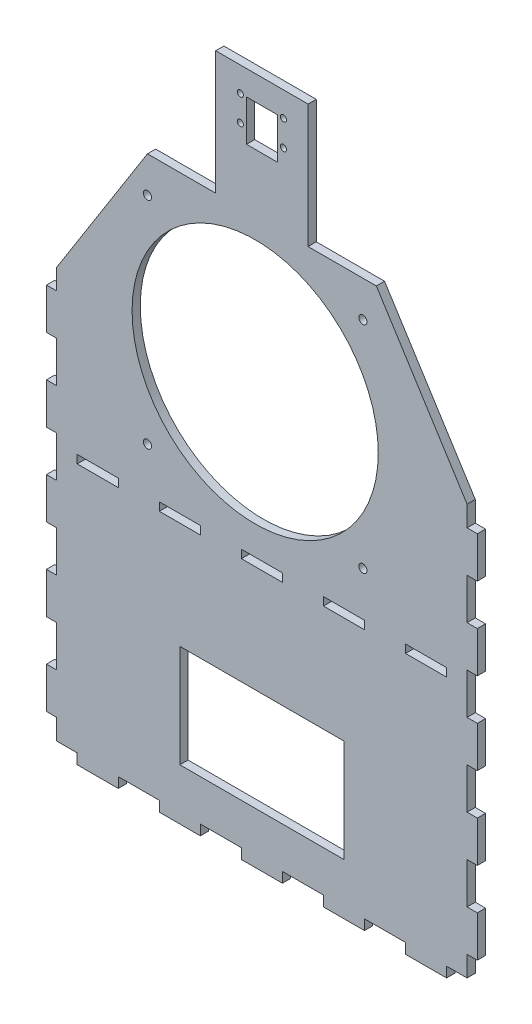
from build123d import *

# Parameters (mm, degrees)
SKICA1_W                = 20
SKICA1_H                = 4
SKICA1_R                = 2
SKICA1_W_2              = 80
SKICA1_H_2              = 50
SKICA1_R_2              = 60
SKICA1_R_3              = 1.5
SKICA1_W_3              = 15
SKICA1_H_3              = 20
P_IDAT_VYSUNUT_M1_DEPTH = 4


with BuildPart() as part:
    # Skica1 → Přidat vysunutím1 (new body)
    with BuildSketch(Plane.XY):
        Polygon((-121.598141023, -103.240049383), (-121.598141023, -113.240049383), (-111.598141023, -113.240049383), (-111.598141023, -118.240049383), (-91.598141023, -118.240049383), (-91.598141023, -113.240049383), (-71.598141023, -113.240049383), (-71.598141023, -118.240049383), (-51.598141023, -118.240049383), (-51.598141023, -113.240049383), (-31.598141023, -113.240049383), (-31.598141023, -118.240049383), (-11.598141023, -118.240049383), (-11.598141023, -113.240049383), (8.401858977, -113.240049383), (8.401858977, -118.240049383), (28.401858977, -118.240049383), (28.401858977, -113.240049383), (48.401858977, -113.240049383), (48.401858977, -118.240049383), (68.401858977, -118.240049383), (68.401858977, -113.240049383), (78.401858977, -113.240049383), (78.401858977, -103.240049383), (83.401858977, -103.240049383), (83.401858977, -83.240049383), (78.401858977, -83.240049383), (78.401858977, -63.240049383), (83.401858977, -63.240049383), (83.401858977, -43.240049383), (78.401858977, -43.240049383), (78.401858977, -23.240049383), (83.401858977, -23.240049383), (83.401858977, -3.240049383), (78.401858977, -3.240049383), (78.401858977, 16.759950617), (83.401858977, 16.759950617), (83.401858977, 36.759950617), (78.401858977, 36.759950617), (78.401858977, 56.759950617), (83.401858977, 56.759950617), (83.401858977, 76.759950617), (78.401858977, 76.759950617), (78.401858977, 86.759950617), (34.183586154, 156.759950617), (0.901858977, 156.759950617), (0.901858977, 216.89905968), (-44.098141023, 216.89905968), (-44.098141023, 156.759950617), (-77.379868199, 156.759950617), (-121.598141023, 86.759950617), (-121.598141023, 76.759950617), (-126.598141023, 76.759950617), (-126.598141023, 56.759950617), (-121.598141023, 56.759950617), (-121.598141023, 36.759950617), (-126.598141023, 36.759950617), (-126.598141023, 16.759950617), (-121.598141023, 16.759950617), (-121.598141023, -3.240049383), (-126.598141023, -3.240049383), (-126.598141023, -23.240049383), (-121.598141023, -23.240049383), (-121.598141023, -43.240049383), (-126.598141023, -43.240049383), (-126.598141023, -63.240049383), (-121.598141023, -63.240049383), (-121.598141023, -83.240049383), (-126.598141023, -83.240049383), (-126.598141023, -103.240049383), align=None)
        with Locations((-101.598141023, 10.759950617)):
            Rectangle(SKICA1_W, SKICA1_H, mode=Mode.SUBTRACT)
        with Locations((-77.379868199, 34.259950617)):
            Circle(SKICA1_R, mode=Mode.SUBTRACT)
        with Locations((-61.598141023, 10.759950617)):
            Rectangle(SKICA1_W, SKICA1_H, mode=Mode.SUBTRACT)
        with Locations((-21.598141023, -68.240049383)):
            Rectangle(SKICA1_W_2, SKICA1_H_2, mode=Mode.SUBTRACT)
        with Locations((-21.598141023, 10.759950617)):
            Rectangle(SKICA1_W, SKICA1_H, mode=Mode.SUBTRACT)
        with Locations((18.401858977, 10.759950617)):
            Rectangle(SKICA1_W, SKICA1_H, mode=Mode.SUBTRACT)
        with Locations((27.620131801, 34.259950617)):
            Circle(SKICA1_R, mode=Mode.SUBTRACT)
        with Locations((58.401858977, 10.759950617)):
            Rectangle(SKICA1_W, SKICA1_H, mode=Mode.SUBTRACT)
        with Locations((-24.879868199, 86.759950617)):
            Circle(SKICA1_R_2, mode=Mode.SUBTRACT)
        with Locations((-77.379868199, 139.259950617)):
            Circle(SKICA1_R, mode=Mode.SUBTRACT)
        with Locations((27.620131801, 139.259950617)):
            Circle(SKICA1_R, mode=Mode.SUBTRACT)
        with Locations((-11.098141023, 204.89905968)):
            Circle(SKICA1_R_3, mode=Mode.SUBTRACT)
        with Locations((-32.098141023, 192.39905968)):
            Circle(SKICA1_R_3, mode=Mode.SUBTRACT)
        with Locations((-32.098141023, 204.89905968)):
            Circle(SKICA1_R_3, mode=Mode.SUBTRACT)
        with Locations((-21.598141023, 194.89905968)):
            Rectangle(SKICA1_W_3, SKICA1_H_3, mode=Mode.SUBTRACT)
        with Locations((-11.098141023, 192.39905968)):
            Circle(SKICA1_R_3, mode=Mode.SUBTRACT)
    extrude(amount=P_IDAT_VYSUNUT_M1_DEPTH)


solid = part.part
